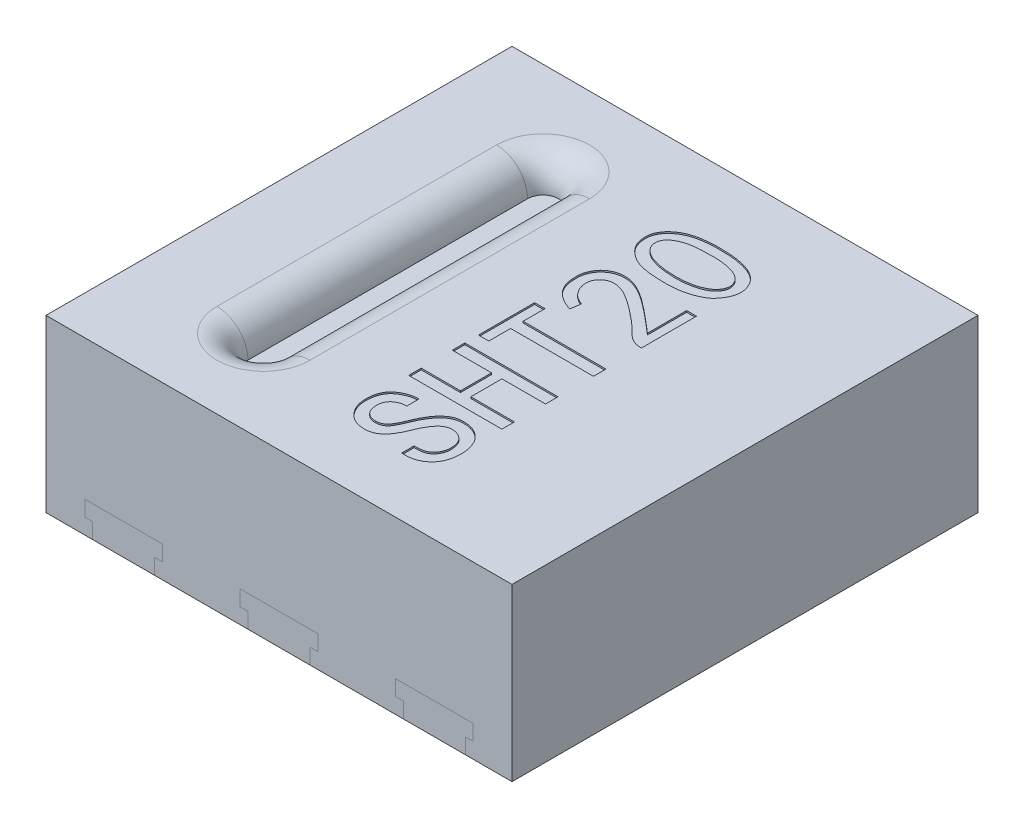
from build123d import *

# Parameters (mm, degrees)
SKETCH_1_W          = 3
SKETCH_1_H          = 3
EXTRUDE_1_DEPTH     = 1.1
CUT_EXTRUDE_1_DEPTH = 0.2
FILLET_1_R          = 0.2
CUT_EXTRUDE_2_DEPTH = 0.01


with BuildPart() as part:
    # 草图1 → 凸台-拉伸1 (new body)
    with BuildSketch(Plane(origin=(0, 0, 0), x_dir=(1, 0, 0), z_dir=(0, 1, 0))):
        with Locations((1.5, 1.5)):
            Rectangle(SKETCH_1_W, SKETCH_1_H)
    extrude(amount=EXTRUDE_1_DEPTH)

    # 草图6 → 切除-拉伸1 (cut)
    with BuildSketch(Plane(origin=(0, 1.1, 0), x_dir=(1, 0, 0), z_dir=(0, 1, 0))):
        with BuildLine():
            Line((0.7, 0.6), (0.7, 2.4))
            ThreePointArc((0.7, 2.4), (0.8, 2.5), (0.9, 2.4))
            Line((0.9, 2.4), (0.9, 0.6))
            ThreePointArc((0.9, 0.6), (0.8, 0.5), (0.7, 0.6))
        make_face()
    extrude(amount=-CUT_EXTRUDE_1_DEPTH, mode=Mode.SUBTRACT)

    # 圆角1
    fillet_1_edges = [part.edges().sort_by_distance(p)[0] for p in [
        (0.8, 1.1, -2.5),
        (0.9, 1.1, -1.5),
        (0.8, 1.1, -0.5),
        (0.7, 1.1, -1.5),
    ]]
    fillet(fillet_1_edges, radius=FILLET_1_R - 0.0001)  # a hair under: the kernel refuses the full size

    # 草图9 → 切除-拉伸2 (cut)
    # profile 1 of 5: a face of its own
    with BuildSketch(Plane(origin=(0, 1.1, 0), x_dir=(1, 0, 0), z_dir=(0, 1, 0))):
        with BuildLine():
            add(Edge.make_bspline(
                [(1.763387628, 2.173293288), (1.755846719, 2.17362722), (1.741138836, 2.174278525), (1.719693545, 2.176164077), (1.699438211, 2.178423602), (1.680399486, 2.181402969), (1.662592546, 2.185065059), (1.645909584, 2.189159278), (1.63047064, 2.193961822), (1.611662829, 2.200999525), (1.590029317, 2.211510581), (1.566332095, 2.226688142), (1.544953913, 2.244179636), (1.529288037, 2.260780553), (1.518251133, 2.275165539), (1.511107419, 2.286667943), (1.504927844, 2.29870657), (1.500189983, 2.311493497), (1.496212727, 2.324705794), (1.493537641, 2.338598851), (1.491819768, 2.353060067), (1.491320329, 2.367969789), (1.492025992, 2.38298967), (1.494330532, 2.397744969), (1.498419987, 2.411984059), (1.504037339, 2.425713818), (1.511243701, 2.438908353), (1.520016584, 2.45156642), (1.530390453, 2.463739689), (1.542279968, 2.47528077), (1.555331061, 2.486185425), (1.569426512, 2.4959709), (1.584161273, 2.505118242), (1.599907287, 2.512895265), (1.616338492, 2.520031566), (1.633645152, 2.525965337), (1.651760791, 2.530885497), (1.677354927, 2.536299373), (1.711303943, 2.541063813), (1.754227606, 2.5444162), (1.79999884, 2.545186602), (1.839575615, 2.544043833), (1.871677688, 2.541897971), (1.895002554, 2.539439694), (1.917146813, 2.536183092), (1.938206032, 2.532346733), (1.958033671, 2.527568049), (1.976691447, 2.521902569), (1.994301672, 2.515781893), (2.010679131, 2.50857736), (2.025962934, 2.500730532), (2.039957299, 2.491784467), (2.05285125, 2.482092657), (2.064542609, 2.471398182), (2.074795864, 2.459561708), (2.084105776, 2.446995044), (2.092029552, 2.433360705), (2.098753673, 2.419021998), (2.104105126, 2.404254241), (2.107593359, 2.389241659), (2.109665496, 2.374267971), (2.109676671, 2.359225761), (2.108355438, 2.344211216), (2.104963827, 2.329246079), (2.100026125, 2.314264155), (2.093390525, 2.299498937), (2.085670214, 2.285325996), (2.077394794, 2.271968335), (2.068355119, 2.259872107), (2.058870024, 2.248732673), (2.048691701, 2.238695279), (2.037907821, 2.229682667), (2.026454636, 2.221854922), (2.010339773, 2.213104818), (1.98955245, 2.203730689), (1.963946999, 2.194032514), (1.93768879, 2.186077935), (1.915104502, 2.181015375), (1.896214148, 2.177638468), (1.880803582, 2.175800129), (1.864214417, 2.174176906), (1.84639409, 2.173211471), (1.827330372, 2.172569739), (1.807052329, 2.172286041), (1.785605502, 2.172587471), (1.770924337, 2.173053862), (1.763387628, 2.173293288)],
                knots=[0, 0, 0, 0, 1.180445055, 2.302354997, 3.366284588, 4.367649516, 5.315026985, 6.208930801, 7.053241086, 7.8422433, 9.348223923, 10.804746523, 12.234358955, 13.657857779, 14.363835946, 15.066914807, 15.772892975, 16.476265567, 17.196597099, 17.928716629, 18.685893904, 19.472273777, 20.259237147, 21.034476724, 21.802249458, 22.570978173, 23.350145282, 24.148861505, 24.975591512, 25.847556331, 26.737574764, 27.632299805, 28.529330512, 29.447401669, 30.376160281, 31.329623129, 32.30592095, 33.310512368, 35.419400723, 37.662115649, 40.040652125, 42.575639009, 43.852401256, 45.071958699, 46.242818464, 47.352386239, 48.418858284, 49.430552595, 50.401286613, 51.332734889, 52.226690053, 53.085634001, 53.927112485, 54.747012775, 55.55835872, 56.37278218, 57.189653686, 58.020123004, 58.847297072, 59.641026584, 60.426764109, 61.205931217, 61.988625051, 62.779341636, 63.599913471, 64.452232006, 65.307104853, 66.122936134, 66.907504405, 67.666619127, 68.409197148, 69.140469771, 69.86207465, 70.57475053, 72.005694827, 73.425108673, 74.854721104, 76.292864884, 77.042487257, 77.855105148, 78.719376593, 79.649147826, 80.645664947, 81.702668967, 82.820644239, 84, 84, 84, 84], degree=3))
        make_face()
        with BuildLine():
            add(Edge.make_bspline(
                [(1.742334996, 2.246977499), (1.750257142, 2.246180912), (1.765864044, 2.244611608), (1.789016612, 2.243327855), (1.811513655, 2.242962906), (1.83336485, 2.243294913), (1.854568368, 2.244599763), (1.875086627, 2.246769002), (1.894931979, 2.249948376), (1.914027803, 2.253771995), (1.932141354, 2.258380333), (1.948993231, 2.263831316), (1.96447419, 2.270087376), (1.978644274, 2.276889794), (1.991409544, 2.284476258), (2.002731698, 2.292829232), (2.012869486, 2.301766219), (2.021389641, 2.31154624), (2.028545046, 2.32157753), (2.034103139, 2.331833164), (2.038047126, 2.342146622), (2.04043961, 2.352555063), (2.041268485, 2.363032337), (2.040298718, 2.373549923), (2.037760143, 2.384076001), (2.033757612, 2.394525885), (2.028272202, 2.404608698), (2.021649368, 2.414155436), (2.013732907, 2.422902268), (2.004736339, 2.431045028), (1.994340221, 2.438311947), (1.982803079, 2.444898651), (1.970054985, 2.45078462), (1.951413616, 2.457648428), (1.926636666, 2.46455261), (1.895631238, 2.470756551), (1.863282711, 2.474349794), (1.830101004, 2.47531548), (1.79717196, 2.474691925), (1.765274673, 2.473951631), (1.734904901, 2.472165815), (1.705951465, 2.470029002), (1.678285064, 2.466402476), (1.652050584, 2.459719324), (1.627177007, 2.45035814), (1.607541561, 2.440750025), (1.593289057, 2.431541606), (1.583724485, 2.424283043), (1.575737545, 2.416211044), (1.56890977, 2.407707582), (1.563769261, 2.398524589), (1.559687627, 2.388887073), (1.557332221, 2.378597855), (1.556133082, 2.367957321), (1.556340918, 2.357227803), (1.558234749, 2.34669824), (1.561487184, 2.336439321), (1.566365773, 2.326544375), (1.572667657, 2.316999419), (1.580447479, 2.307812823), (1.589758905, 2.299030353), (1.600374571, 2.290381874), (1.61269943, 2.282491965), (1.626506411, 2.275196331), (1.641970903, 2.268722663), (1.658969692, 2.262953848), (1.677516339, 2.257704239), (1.697703489, 2.253337471), (1.719486403, 2.249741267), (1.734573226, 2.247916363), (1.742334996, 2.246977499)],
                knots=[0, 0, 0, 0, 1.378204679, 2.715111164, 4.012613494, 5.272627197, 6.497243734, 7.688906153, 8.842857779, 9.975264062, 11.059261695, 12.076598286, 13.038825469, 13.947707782, 14.795214618, 15.605129028, 16.380457275, 17.129633147, 17.84533494, 18.509653294, 19.143342443, 19.750937343, 20.35253311, 20.954736149, 21.571334305, 22.221708676, 22.88602703, 23.553806938, 24.228248261, 24.923868472, 25.650022435, 26.419234173, 27.221089185, 28.077703583, 29.855572281, 31.66741861, 33.546409625, 35.482299018, 37.409644032, 39.247620849, 41.005066029, 42.675281928, 44.273459751, 45.828498021, 47.349515399, 48.868701618, 49.600870978, 50.284874625, 50.942386259, 51.561941302, 52.166520823, 52.758363011, 53.367667692, 53.986268978, 54.60885719, 55.217884935, 55.832107334, 56.465973938, 57.121129429, 57.807635962, 58.544856937, 59.334201523, 60.174511851, 61.073502881, 62.034531282, 63.073228514, 64.179511193, 65.369473598, 66.646664004, 68, 68, 68, 68], degree=3))
        make_face(mode=Mode.SUBTRACT)
    # profile 2 of 5: a face of its own
    with BuildSketch(Plane(origin=(0, 1.1, 0), x_dir=(1, 0, 0), z_dir=(0, 1, 0))):
        with BuildLine():
            add(Edge.make_bspline(
                [(1.933628044, 0.752240657), (1.940175981, 0.752096345), (1.952968949, 0.751814397), (1.971689667, 0.749450112), (1.989364169, 0.745449766), (2.006006725, 0.739839839), (2.021564301, 0.732658019), (2.036123949, 0.723915657), (2.049553641, 0.713435362), (2.061867301, 0.701448478), (2.073075583, 0.688247193), (2.082757282, 0.673725341), (2.090785141, 0.657969852), (2.097615856, 0.641180055), (2.102777035, 0.623181069), (2.106379808, 0.604036624), (2.108614593, 0.583785794), (2.108913726, 0.569877027), (2.10906664, 0.562766972)],
                knots=[0, 0, 0, 0, 1.076259056, 2.102730573, 3.09615591, 4.05107809, 4.984729369, 5.908110826, 6.836941787, 7.778787535, 8.728970618, 9.679073625, 10.641034314, 11.631596305, 12.654875673, 13.713625689, 14.831223164, 16, 16, 16, 16], degree=3))
            add(Edge.make_bspline(
                [(2.10906664, 0.562766972), (2.108927156, 0.555655717), (2.108655045, 0.541782813), (2.106247273, 0.521620386), (2.102511637, 0.502607433), (2.097261448, 0.484748357), (2.090191648, 0.468181179), (2.081634203, 0.452856281), (2.071825536, 0.438523481), (2.060143393, 0.425815844), (2.047663142, 0.414157535), (2.034011583, 0.404344318), (2.019820138, 0.395755466), (2.004744621, 0.388902502), (1.988992117, 0.383329002), (1.972354617, 0.37967952), (1.955014226, 0.37721552), (1.943166989, 0.376941523), (1.937136816, 0.37680206)],
                knots=[0, 0, 0, 0, 1.196484868, 2.334147444, 3.412243803, 4.454848227, 5.460999767, 6.436818592, 7.405612426, 8.376187812, 9.335968902, 10.275091469, 11.200357791, 12.123553648, 13.057369033, 14.007128931, 14.985640427, 16, 16, 16, 16], degree=3))
            Line((1.937136816, 0.37680206), (1.912575412, 0.37680206))
            Line((1.912575412, 0.37680206), (1.912575412, 0.457503815))
            Line((1.912575412, 0.457503815), (1.933628044, 0.457503815))
            add(Edge.make_bspline(
                [(1.933628044, 0.457503815), (1.937876719, 0.457612425), (1.946182027, 0.457824738), (1.95824404, 0.459216355), (1.9695649, 0.461701833), (1.980062891, 0.465187298), (1.98984346, 0.469648386), (1.99880541, 0.475129296), (2.007108126, 0.481520091), (2.016818113, 0.491390143), (2.027065134, 0.504999343), (2.035929568, 0.523080122), (2.04154712, 0.54246298), (2.042112694, 0.55592768), (2.042399973, 0.562766972)],
                knots=[0, 0, 0, 0, 0.89970853, 1.758749939, 2.566656616, 3.349866332, 4.096893782, 4.837870496, 5.569993442, 6.309435511, 7.764284211, 9.154994143, 10.554900695, 12, 12, 12, 12], degree=3))
            add(Edge.make_bspline(
                [(2.042399973, 0.562766972), (2.042278682, 0.567273943), (2.042042587, 0.576046764), (2.040840998, 0.588763096), (2.038445282, 0.600533121), (2.035311592, 0.611399785), (2.030871543, 0.621199542), (2.025921546, 0.630279387), (2.019704892, 0.638267939), (2.010362108, 0.647496098), (1.997334056, 0.657245978), (1.979758248, 0.665457802), (1.960688805, 0.67061996), (1.947436724, 0.671227542), (1.940645587, 0.671538902)],
                knots=[0, 0, 0, 0, 0.962440328, 1.873391043, 2.722138851, 3.523734004, 4.281456455, 5.014396504, 5.726506092, 6.432706956, 7.814287824, 9.175195494, 10.55240578, 12, 12, 12, 12], degree=3))
            add(Edge.make_bspline(
                [(1.940645587, 0.671538902), (1.937737269, 0.671431517), (1.931972417, 0.671218658), (1.923379953, 0.669725509), (1.914942839, 0.667293637), (1.906720534, 0.663678343), (1.898598445, 0.659308149), (1.89080544, 0.653690304), (1.882956849, 0.647396394), (1.872699756, 0.637149746), (1.860275366, 0.622018895), (1.846431958, 0.600784683), (1.833150674, 0.576125563), (1.825407612, 0.558155133), (1.821347342, 0.548731885)],
                knots=[0, 0, 0, 0, 0.578138014, 1.145981947, 1.729294273, 2.319686506, 2.928759201, 3.559612696, 4.226874004, 4.927334085, 6.438251822, 8.110552943, 9.960470262, 12, 12, 12, 12], degree=3))
            add(Edge.make_bspline(
                [(1.821347342, 0.548731885), (1.818703389, 0.54195748), (1.813569425, 0.528803106), (1.805401341, 0.509914867), (1.796964254, 0.492542969), (1.788423306, 0.47654906), (1.779458697, 0.462184713), (1.770368432, 0.449198536), (1.760987428, 0.437773972), (1.751519676, 0.427591106), (1.74146964, 0.419005269), (1.731255432, 0.411323908), (1.720352224, 0.405142899), (1.709174264, 0.399877877), (1.697506136, 0.395798448), (1.685383493, 0.393023761), (1.672830277, 0.391047663), (1.66428361, 0.390908043), (1.659943833, 0.390837148)],
                knots=[0, 0, 0, 0, 1.442752318, 2.801501104, 4.081506638, 5.273637195, 6.396923968, 7.438988766, 8.41619664, 9.328106494, 10.193211603, 11.035517752, 11.859560831, 12.674726742, 13.484711172, 14.306060706, 15.139861387, 16, 16, 16, 16], degree=3))
            add(Edge.make_bspline(
                [(1.659943833, 0.390837148), (1.653958819, 0.390984771), (1.642201481, 0.391274772), (1.624985301, 0.39361936), (1.608661297, 0.397668354), (1.593224485, 0.403260961), (1.578685228, 0.410485387), (1.564987439, 0.419217314), (1.552137123, 0.429553681), (1.540458089, 0.441480885), (1.529868454, 0.45444257), (1.520422372, 0.468056946), (1.512632523, 0.482431437), (1.506242079, 0.497364402), (1.501092384, 0.512814698), (1.497684349, 0.528951151), (1.495314317, 0.545629175), (1.495126754, 0.556997004), (1.495031552, 0.562766972)],
                knots=[0, 0, 0, 0, 1.07870255, 2.119071136, 3.124805643, 4.105581286, 5.072990272, 6.045680189, 7.028691787, 8.039235481, 9.049145311, 10.043383937, 11.021887354, 11.990902522, 12.968844852, 13.952259623, 14.960628413, 16, 16, 16, 16], degree=3))
            add(Edge.make_bspline(
                [(1.495031552, 0.562766972), (1.495222928, 0.570093528), (1.495594358, 0.584313202), (1.497965738, 0.604837172), (1.502298956, 0.623773538), (1.508233176, 0.641090665), (1.515823518, 0.656938623), (1.525147706, 0.671172459), (1.536409194, 0.683682596), (1.54916124, 0.694511366), (1.56289326, 0.703845253), (1.576982826, 0.712056198), (1.591249757, 0.719169553), (1.60591347, 0.724723651), (1.620766147, 0.729156744), (1.635906478, 0.732497737), (1.651367197, 0.734274857), (1.661759225, 0.73455604), (1.666961377, 0.734696797)],
                knots=[0, 0, 0, 0, 1.28200282, 2.488162422, 3.607876601, 4.67451564, 5.684699519, 6.674808952, 7.640986039, 8.619275895, 9.594772521, 10.542429609, 11.471197476, 12.380494384, 13.282146407, 14.18153381, 15.089692832, 16, 16, 16, 16], degree=3))
            Line((1.666961377, 0.734696797), (1.666961377, 0.653995043))
            add(Edge.make_bspline(
                [(1.666961377, 0.653995043), (1.660666259, 0.654253947), (1.648266332, 0.654763929), (1.629918715, 0.651010108), (1.612514754, 0.643870084), (1.59909216, 0.635135935), (1.589293968, 0.626665358), (1.582882065, 0.619420927), (1.577403148, 0.61163213), (1.572882764, 0.603129901), (1.569428669, 0.593952825), (1.566937863, 0.584103103), (1.565521999, 0.573637743), (1.56531381, 0.566453252), (1.565206991, 0.562766972)],
                knots=[0, 0, 0, 0, 1.460277153, 2.876408615, 4.312700685, 5.812754337, 6.576349981, 7.318184748, 8.055769063, 8.785612399, 9.550601407, 10.329777546, 11.143028139, 12, 12, 12, 12], degree=3))
            add(Edge.make_bspline(
                [(1.565206991, 0.562766972), (1.565443433, 0.556067378), (1.565894195, 0.543295047), (1.570334127, 0.525263765), (1.577299896, 0.509268295), (1.587473781, 0.495753461), (1.600000654, 0.484860568), (1.614724137, 0.476973351), (1.63147181, 0.47237293), (1.643280369, 0.471824127), (1.649417517, 0.471538902)],
                knots=[0, 0, 0, 0, 1.145196218, 2.183240533, 3.159303635, 4.113187715, 5.054501613, 5.980375362, 6.950360008, 8, 8, 8, 8], degree=3))
            add(Edge.make_bspline(
                [(1.649417517, 0.471538902), (1.654508913, 0.471740987), (1.664483147, 0.472136878), (1.678838733, 0.475919518), (1.692078713, 0.48200851), (1.70236416, 0.489121981), (1.710056026, 0.496888547), (1.716163346, 0.504664444), (1.722464595, 0.51438512), (1.729252822, 0.525908138), (1.735999097, 0.53951346), (1.743372941, 0.554813388), (1.750689938, 0.572185365), (1.755608814, 0.58441894), (1.758189447, 0.590837148)],
                knots=[0, 0, 0, 0, 1.054599539, 2.066000132, 3.055236876, 4.067595311, 4.639532213, 5.317449549, 6.115078722, 7.04144999, 8.090482295, 9.264325581, 10.564759249, 12, 12, 12, 12], degree=3))
            add(Edge.make_bspline(
                [(1.758189447, 0.590837148), (1.76082225, 0.597098648), (1.765986338, 0.609380214), (1.774483163, 0.627048275), (1.783223155, 0.643741988), (1.792654061, 0.659108349), (1.802104739, 0.673583362), (1.812151884, 0.686814778), (1.822502163, 0.699066312), (1.833311659, 0.7101462), (1.844475515, 0.720059112), (1.856032199, 0.728718), (1.868115286, 0.735855194), (1.880406005, 0.741917317), (1.893205787, 0.746460732), (1.906275694, 0.749883325), (1.919835053, 0.751874873), (1.928986612, 0.752117568), (1.933628044, 0.752240657)],
                knots=[0, 0, 0, 0, 1.28605471, 2.522520843, 3.711463364, 4.852377266, 5.935318125, 6.983656505, 7.996177383, 8.970703677, 9.912147403, 10.821044325, 11.700288743, 12.566114681, 13.412010411, 14.26751643, 15.121329739, 16, 16, 16, 16], degree=3))
        make_face()
    # profile 3 of 5: a face of its own
    with BuildSketch(Plane(origin=(0, 1.1, 0), x_dir=(1, 0, 0), z_dir=(0, 1, 0))):
        Polygon((2.102049096, 1.19434592), (2.102049096, 1.113644165), (1.821347342, 1.113644165), (1.821347342, 0.913644165), (2.102049096, 0.913644165), (2.102049096, 0.832942411), (1.502049096, 0.832942411), (1.502049096, 0.913644165), (1.754680675, 0.913644165), (1.754680675, 1.113644165), (1.502049096, 1.113644165), (1.502049096, 1.19434592), align=None)
    # profile 4 of 5: a face of its own
    with BuildSketch(Plane(origin=(0, 1.1, 0), x_dir=(1, 0, 0), z_dir=(0, 1, 0))):
        Polygon((1.568715763, 1.643468727), (1.568715763, 1.50311785), (2.102049096, 1.50311785), (2.102049096, 1.422416095), (1.568715763, 1.422416095), (1.568715763, 1.282065218), (1.502049096, 1.282065218), (1.502049096, 1.643468727), align=None)
    # profile 5 of 5: a face of its own
    with BuildSketch(Plane(origin=(0, 1.1, 0), x_dir=(1, 0, 0), z_dir=(0, 1, 0))):
        with BuildLine():
            add(Edge.make_bspline(
                [(2.084505237, 1.734696797), (2.080159024, 1.735121246), (2.071520705, 1.73596486), (2.058812612, 1.738927139), (2.046405007, 1.743095283), (2.034303455, 1.748578951), (2.022503049, 1.755349873), (2.011253636, 1.763678284), (2.000059369, 1.77297839), (1.989478956, 1.784100643), (1.978220919, 1.796092364), (1.965336686, 1.80851547), (1.951261844, 1.821961719), (1.93541529, 1.835957424), (1.918236172, 1.850838597), (1.899574876, 1.866492053), (1.879425141, 1.882862734), (1.858203766, 1.899579989), (1.836994109, 1.916094276), (1.81643883, 1.931201714), (1.797351948, 1.945082166), (1.779463755, 1.957344224), (1.762657842, 1.967844936), (1.74719585, 1.97695717), (1.733112301, 1.984733824), (1.716291522, 1.992493776), (1.696892854, 1.999817718), (1.674855288, 2.005560512), (1.654460064, 2.008169911), (1.63571745, 2.007144647), (1.618616067, 2.003113942), (1.603092011, 1.996082921), (1.589109589, 1.986158936), (1.577056704, 1.973613782), (1.567200887, 1.959201008), (1.560794726, 1.943125875), (1.557409336, 1.926019182), (1.557741692, 1.908087707), (1.560888597, 1.889978664), (1.56672463, 1.872064872), (1.575128843, 1.85460498), (1.585977657, 1.837646069), (1.599858046, 1.82188159), (1.616981042, 1.808035619), (1.637226869, 1.796254247), (1.652184991, 1.790376954), (1.659943833, 1.787328376)],
                knots=[0, 0, 0, 0, 0.68324931, 1.357992617, 2.038035037, 2.730284322, 3.43541055, 4.164095581, 4.91978436, 5.711285425, 6.565347062, 7.495992796, 8.513340264, 9.613596236, 10.806353808, 12.072750425, 13.427835217, 14.871897714, 16.303429279, 17.63715395, 18.866599259, 19.999315079, 21.032640925, 21.969226408, 22.810037557, 23.550593805, 24.868612452, 26.051607131, 27.110166319, 28.074996885, 28.975023992, 29.846369167, 30.727248145, 31.643566772, 32.557974933, 33.443569333, 34.334964858, 35.271157169, 36.234746795, 37.204430329, 38.211822504, 39.261804213, 40.347978988, 41.485883341, 42.695916775, 44, 44, 44, 44], degree=3))
            Line((1.659943833, 1.787328376), (1.649417517, 1.720661709))
            add(Edge.make_bspline(
                [(1.649417517, 1.720661709), (1.64289142, 1.723015262), (1.63019447, 1.727594254), (1.61211667, 1.735482315), (1.595281042, 1.743619188), (1.579801773, 1.752297931), (1.565706127, 1.761515029), (1.553034044, 1.771309421), (1.541702938, 1.781536713), (1.531743355, 1.792310344), (1.522921949, 1.803518759), (1.515469207, 1.815425538), (1.508778972, 1.827624165), (1.50313769, 1.840346781), (1.49857951, 1.853557518), (1.495267726, 1.867326579), (1.492697596, 1.881510029), (1.491917738, 1.891195253), (1.49152278, 1.896100306)],
                knots=[0, 0, 0, 0, 1.318489008, 2.565206815, 3.747405244, 4.871986395, 5.936312274, 6.946003669, 7.913720337, 8.834395417, 9.732136242, 10.620766564, 11.501424885, 12.375164454, 13.263184087, 14.153948527, 15.065072702, 16, 16, 16, 16], degree=3))
            add(Edge.make_bspline(
                [(1.49152278, 1.896100306), (1.491059767, 1.901814567), (1.490159295, 1.912927698), (1.490056478, 1.929208055), (1.490891807, 1.944591747), (1.492978773, 1.95930746), (1.496490113, 1.973726204), (1.501952992, 1.988092261), (1.509056964, 2.002662737), (1.517606317, 2.017513922), (1.528482068, 2.031820551), (1.541885707, 2.044949755), (1.557831275, 2.056473498), (1.575847457, 2.06678306), (1.59610949, 2.075101099), (1.618676572, 2.080103702), (1.643113421, 2.081937522), (1.664664085, 2.080929482), (1.682932031, 2.078460174), (1.697585411, 2.075052624), (1.712796426, 2.07010663), (1.728790703, 2.064169271), (1.745306791, 2.056568052), (1.762561396, 2.047673249), (1.780408205, 2.037412904), (1.795716837, 2.027835415), (1.80849864, 2.019235845), (1.819034661, 2.012181982), (1.830096033, 2.00414914), (1.841879267, 1.995486145), (1.854345886, 1.986116366), (1.867512446, 1.976118868), (1.88124225, 1.96531621), (1.895714077, 1.953841483), (1.910902302, 1.941710555), (1.926597324, 1.928616099), (1.943099731, 1.91502137), (1.960294806, 1.900731171), (1.978049287, 1.885589996), (1.996675608, 1.86997381), (2.015738703, 1.853364568), (2.028749072, 1.84216255), (2.03538243, 1.836451183)],
                knots=[0, 0, 0, 0, 0.92421929, 1.797427642, 2.623159043, 3.406557121, 4.19098228, 5.011020959, 5.879578741, 6.803269905, 7.770091595, 8.767910272, 9.81716943, 10.934010526, 12.109247782, 13.334431608, 14.644905237, 16.050386148, 16.805137353, 17.6151175, 18.47230853, 19.383098903, 20.364746325, 21.401984688, 22.512758034, 23.683419128, 24.313078477, 24.997010098, 25.727849061, 26.517235061, 27.355488255, 28.242667054, 29.183111138, 30.172606021, 31.221004473, 32.317541081, 33.468635314, 34.668912549, 35.922892041, 37.231427981, 38.588439115, 40, 40, 40, 40], degree=3))
            Line((2.03538243, 1.836451183), (2.03538243, 2.089082762))
            Line((2.03538243, 2.089082762), (2.098540324, 2.089082762))
            Line((2.098540324, 2.089082762), (2.098540324, 1.734696797))
            Line((2.098540324, 1.734696797), (2.084505237, 1.734696797))
        make_face()
    extrude(amount=-CUT_EXTRUDE_2_DEPTH, mode=Mode.SUBTRACT)


solid = part.part
